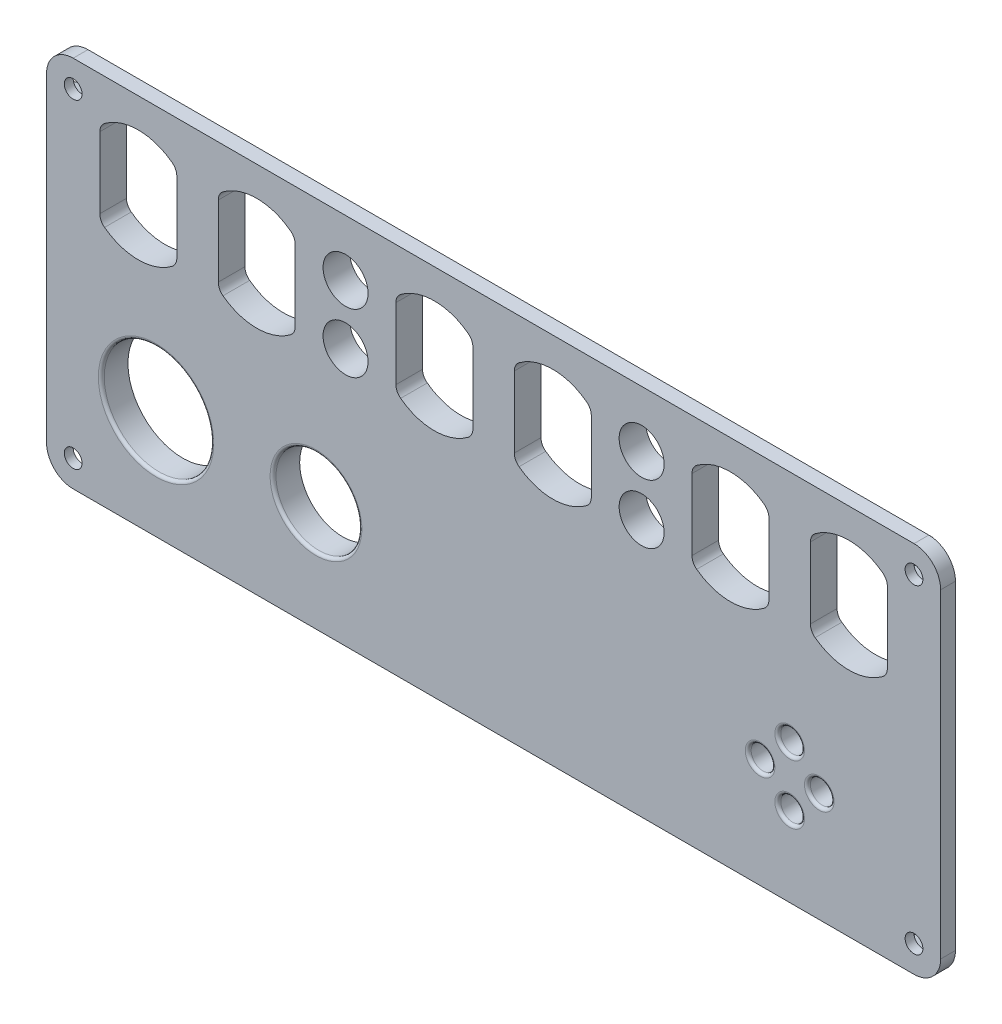
from build123d import *

# Parameters (mm, degrees)
SKETCH_1_R          = 1.5
EXTRUDE_1_DEPTH     = 4.5
CUT_EXTRUDE_START   = -3
SKETCH_2_R          = 1.5
CUT_EXTRUDE_1_DEPTH = 3
SKETCH_3_R          = 3.8
CUT_EXTRUDE_2_DEPTH = 6
SKETCH_4_R          = 9.25
SKETCH_4_R_2        = 7.25
CUT_EXTRUDE_3_DEPTH = 6
SKETCH_5_R          = 2
CUT_EXTRUDE_4_DEPTH = 5
FILLET_1_R          = 2
CUT_EXTRUDE_START_2 = -2
CUT_EXTRUDE_5_DEPTH = 2
FILLET_2_R          = 1
FILLET_3_R          = 0.5
FILLET_4_R          = 0.5


with BuildPart() as part:
    # 草图1 → 凸台-拉伸1 (new body)
    with BuildSketch(Plane.XY):
        with BuildLine():
            Line((-71, 31.5), (71, 31.5))
            ThreePointArc((71, 31.5), (74.181980515, 30.181980515), (75.5, 27))
            Line((75.5, 27), (75.5, -27))
            ThreePointArc((75.5, -27), (74.181980515, -30.181980515), (71, -31.5))
            Line((71, -31.5), (-71, -31.5))
            ThreePointArc((-71, -31.5), (-74.181980515, -30.181980515), (-75.5, -27))
            Line((-75.5, -27), (-75.5, 27))
            ThreePointArc((-75.5, 27), (-74.181980515, 30.181980515), (-71, 31.5))
        make_face()
        with Locations((-71, 27)):
            Circle(SKETCH_1_R, mode=Mode.SUBTRACT)
        with Locations(Location((71, 27, 0), (0, 0, 180))):
            Circle(SKETCH_1_R, mode=Mode.SUBTRACT)
        with Locations((71, -27)):
            Circle(SKETCH_1_R, mode=Mode.SUBTRACT)
        with Locations(Location((-71, -27, 0), (0, 0, 180))):
            Circle(SKETCH_1_R, mode=Mode.SUBTRACT)
    extrude(amount=-EXTRUDE_1_DEPTH)

    # 草图2 → 切除-拉伸1 (cut)
    # profile 1 of 4: a face of its own
    with BuildSketch(Plane(origin=(0, 0, -4.5), x_dir=(-1, 0, 0), z_dir=(0, 0, -1)).offset(CUT_EXTRUDE_START)):
        Polygon((-71, 23.7), (-68.142116168, 25.35), (-68.142116168, 28.65), (-71, 30.3), (-73.857883832, 28.65), (-73.857883832, 25.35), align=None)
        with Locations((-71, 27)):
            Circle(SKETCH_2_R, mode=Mode.SUBTRACT)
    # profile 2 of 4: a face of its own
    with BuildSketch(Plane(origin=(0, 0, -4.5), x_dir=(-1, 0, 0), z_dir=(0, 0, -1)).offset(CUT_EXTRUDE_START)):
        Polygon((71, 30.3), (73.857883832, 28.65), (73.857883832, 25.35), (71, 23.7), (68.142116168, 25.35), (68.142116168, 28.65), align=None)
    # profile 3 of 4: a face of its own
    with BuildSketch(Plane(origin=(0, 0, -4.5), x_dir=(-1, 0, 0), z_dir=(0, 0, -1)).offset(CUT_EXTRUDE_START)):
        Polygon((73.857883832, -28.65), (73.857883832, -25.35), (71, -23.7), (68.142116168, -25.35), (68.142116168, -28.65), (71, -30.3), align=None)
    # profile 4 of 4: a face of its own
    with BuildSketch(Plane(origin=(0, 0, -4.5), x_dir=(-1, 0, 0), z_dir=(0, 0, -1)).offset(CUT_EXTRUDE_START)):
        Polygon((-71, -30.3), (-73.857883832, -28.65), (-73.857883832, -25.35), (-71, -23.7), (-68.142116168, -25.35), (-68.142116168, -28.65), align=None)
    extrude(amount=CUT_EXTRUDE_1_DEPTH, mode=Mode.SUBTRACT)

    # 草图3 → 切除-拉伸2 (cut)
    with BuildSketch(Plane.XY):
        with Locations((-25, 22)):
            Circle(SKETCH_3_R)
        with Locations(Location((-25, 12, 0), (0, 0, 180))):
            Circle(SKETCH_3_R)
        with Locations((25, 12)):
            Circle(SKETCH_3_R)
        with Locations(Location((25, 22, 0), (0, 0, 180))):
            Circle(SKETCH_3_R)
        with BuildLine():
            Line((-53.5, 17), (-53.5, 23.92820323))
            ThreePointArc((-53.5, 23.92820323), (-60, 26.5), (-66.5, 23.92820323))
            Line((-66.5, 23.92820323), (-66.5, 17))
            Line((-66.5, 17), (-66.5, 10.07179677))
            ThreePointArc((-66.5, 10.07179677), (-60, 7.5), (-53.5, 10.07179677))
            Line((-53.5, 10.07179677), (-53.5, 17))
        make_face()
        with BuildLine():
            Line((-33.5, 17), (-33.5, 10.07179677))
            ThreePointArc((-33.5, 10.07179677), (-40, 7.5), (-46.5, 10.07179677))
            Line((-46.5, 10.07179677), (-46.5, 17))
            Line((-46.5, 17), (-46.5, 23.92820323))
            ThreePointArc((-46.5, 23.92820323), (-40, 26.5), (-33.5, 23.92820323))
            Line((-33.5, 23.92820323), (-33.5, 17))
        make_face()
        with BuildLine():
            Line((-3.5, 17), (-3.5, 10.07179677))
            ThreePointArc((-3.5, 10.07179677), (-10, 7.5), (-16.5, 10.07179677))
            Line((-16.5, 10.07179677), (-16.5, 17))
            Line((-16.5, 17), (-16.5, 23.92820323))
            ThreePointArc((-16.5, 23.92820323), (-10, 26.5), (-3.5, 23.92820323))
            Line((-3.5, 23.92820323), (-3.5, 17))
        make_face()
        with BuildLine():
            Line((16.5, 17), (16.5, 10.07179677))
            ThreePointArc((16.5, 10.07179677), (10, 7.5), (3.5, 10.07179677))
            Line((3.5, 10.07179677), (3.5, 17))
            Line((3.5, 17), (3.5, 23.92820323))
            ThreePointArc((3.5, 23.92820323), (10, 26.5), (16.5, 23.92820323))
            Line((16.5, 23.92820323), (16.5, 17))
        make_face()
        with BuildLine():
            Line((46.5, 17), (46.5, 10.07179677))
            ThreePointArc((46.5, 10.07179677), (40, 7.5), (33.5, 10.07179677))
            Line((33.5, 10.07179677), (33.5, 17))
            Line((33.5, 17), (33.5, 23.92820323))
            ThreePointArc((33.5, 23.92820323), (40, 26.5), (46.5, 23.92820323))
            Line((46.5, 23.92820323), (46.5, 17))
        make_face()
        with BuildLine():
            Line((53.5, 17), (53.5, 10.07179677))
            ThreePointArc((53.5, 10.07179677), (60, 7.5), (66.5, 10.07179677))
            Line((66.5, 10.07179677), (66.5, 17))
            Line((66.5, 17), (66.5, 23.92820323))
            ThreePointArc((66.5, 23.92820323), (60, 26.5), (53.5, 23.92820323))
            Line((53.5, 23.92820323), (53.5, 17))
        make_face()
    extrude(amount=-CUT_EXTRUDE_2_DEPTH, mode=Mode.SUBTRACT)

    # 草图4 → 切除-拉伸3 (cut)
    with BuildSketch(Plane.XY):
        with Locations((-57, -13)):
            Circle(SKETCH_4_R)
        with Locations((-30, -13)):
            Circle(SKETCH_4_R_2)
    extrude(amount=-CUT_EXTRUDE_3_DEPTH, mode=Mode.SUBTRACT)

    # 草图5 → 切除-拉伸4 (cut)
    with BuildSketch(Plane(origin=(0, 0, -4.5), x_dir=(-1, 0, 0), z_dir=(0, 0, -1))):
        with Locations((-45, -13)):
            Circle(SKETCH_5_R)
        with Locations((-55, -13)):
            Circle(SKETCH_5_R)
        with Locations((-50, -8)):
            Circle(SKETCH_5_R)
        with Locations((-50, -18)):
            Circle(SKETCH_5_R)
    extrude(amount=-CUT_EXTRUDE_4_DEPTH, mode=Mode.SUBTRACT)

    # 圆角1
    fillet_1_edges = [part.edges().sort_by_distance(p)[0] for p in [
        (-66.5, 23.92820323, -2.25),
        (-53.5, 23.92820323, -2.25),
        (-53.5, 10.07179677, -2.25),
        (-66.5, 10.07179677, -2.25),
        (-33.5, 23.92820323, -2.25),
        (-33.5, 10.07179677, -2.25),
        (-46.5, 10.07179677, -2.25),
        (-46.5, 23.92820323, -2.25),
        (-3.5, 23.92820323, -2.25),
        (-3.5, 10.07179677, -2.25),
        (-16.5, 10.07179677, -2.25),
        (-16.5, 23.92820323, -2.25),
        (16.5, 23.92820323, -2.25),
        (16.5, 10.07179677, -2.25),
        (3.5, 10.07179677, -2.25),
        (3.5, 23.92820323, -2.25),
        (46.5, 23.92820323, -2.25),
        (46.5, 10.07179677, -2.25),
        (33.5, 10.07179677, -2.25),
        (33.5, 23.92820323, -2.25),
        (66.5, 10.07179677, -2.25),
        (53.5, 10.07179677, -2.25),
        (53.5, 23.92820323, -2.25),
        (66.5, 23.92820323, -2.25),
    ]]
    fillet(fillet_1_edges, radius=FILLET_1_R)

    # 草图6 → 切除-拉伸5 (cut)
    with BuildSketch(Plane(origin=(0, 0, -4.5), x_dir=(-1, 0, 0), z_dir=(0, 0, -1)).offset(CUT_EXTRUDE_START_2)):
        with BuildLine():
            Line((-75.5, -27), (-75.5, 27))
            ThreePointArc((-75.5, 27), (-74.181980515, 30.181980515), (-71, 31.5))
            Line((-71, 31.5), (71, 31.5))
            ThreePointArc((71, 31.5), (74.181980515, 30.181980515), (75.5, 27))
            Line((75.5, 27), (75.5, -27))
            ThreePointArc((75.5, -27), (74.181980515, -30.181980515), (71, -31.5))
            Line((71, -31.5), (-71, -31.5))
            ThreePointArc((-71, -31.5), (-74.181980515, -30.181980515), (-75.5, -27))
        make_face()
        with BuildLine():
            Line((71, -29.5), (-71, -29.5))
            ThreePointArc((-71, -29.5), (-72.767766953, -28.767766953), (-73.5, -27))
            Line((-73.5, -27), (-73.5, 27))
            ThreePointArc((-73.5, 27), (-72.767766953, 28.767766953), (-71, 29.5))
            Line((-71, 29.5), (71, 29.5))
            ThreePointArc((71, 29.5), (72.767766953, 28.767766953), (73.5, 27))
            Line((73.5, 27), (73.5, -27))
            ThreePointArc((73.5, -27), (72.767766953, -28.767766953), (71, -29.5))
        make_face(mode=Mode.SUBTRACT)
    extrude(amount=CUT_EXTRUDE_5_DEPTH, mode=Mode.SUBTRACT)

    # 圆角2
    # the kernel refuses this fillet: 1 mm, written as the material it adds along each edge
    with BuildSketch(Plane(origin=(-73.5, 27.643375673, -2.5), x_dir=(-1, 0, 0), z_dir=(0, -1, 0))) as fillet_2_piece_1_section:
        with BuildLine():
            CenterArc((FILLET_2_R, FILLET_2_R), FILLET_2_R, 180, 90)
            Line((0, FILLET_2_R), (0, 0))
            Line((0, 0), (FILLET_2_R, 0))
        make_face()
    fillet_2_piece_1 = extrude(amount=55.286751346, mode=Mode.PRIVATE)
    fillet_2_piece_1 = split(fillet_2_piece_1, bisect_by=Plane(origin=(-62.998675365, 19.080433068, -2.568269358), z_dir=(-0.4999999999999995, -0.866025403784439, 0)), keep=Keep.TOP, mode=Mode.PRIVATE)
    fillet_2_piece_1 = split(fillet_2_piece_1, bisect_by=Plane(origin=(-62.998675365, -19.080433068, -2.568269358), z_dir=(-0.4999999999999995, 0.866025403784439, 0)), keep=Keep.TOP, mode=Mode.PRIVATE)
    add(fillet_2_piece_1)
    with BuildSketch(Plane(origin=(72.114359354, 29.5, -2.5), x_dir=(0, 1, 0), z_dir=(-1, 0, 0))) as fillet_2_piece_2_section:
        with BuildLine():
            CenterArc((FILLET_2_R, FILLET_2_R), FILLET_2_R, 180, 90)
            Line((0, FILLET_2_R), (0, 0))
            Line((0, 0), (FILLET_2_R, 0))
        make_face()
    fillet_2_piece_2 = extrude(amount=144.228718708, mode=Mode.PRIVATE)
    fillet_2_piece_2 = split(fillet_2_piece_2, bisect_by=Plane(origin=(71.034600917, 30.319976849, -2.504027252), z_dir=(-0.4999999999999995, 0.866025403784439, 0)), keep=Keep.TOP, mode=Mode.PRIVATE)
    fillet_2_piece_2 = split(fillet_2_piece_2, bisect_by=Plane(origin=(35.465399084, -31.167826821, -2.504027252), z_dir=(0.4999999999999987, 0.8660254037844395, 0)), keep=Keep.TOP, mode=Mode.PRIVATE)
    add(fillet_2_piece_2)
    with BuildSketch(Plane(origin=(73.5, -27.643375673, -2.5), x_dir=(1, 0, 0), z_dir=(0, 1, 0))) as fillet_2_piece_3_section:
        with BuildLine():
            CenterArc((FILLET_2_R, FILLET_2_R), FILLET_2_R, 180, 90)
            Line((0, FILLET_2_R), (0, 0))
            Line((0, 0), (FILLET_2_R, 0))
        make_face()
    fillet_2_piece_3 = extrude(amount=55.286751346, mode=Mode.PRIVATE)
    fillet_2_piece_3 = split(fillet_2_piece_3, bisect_by=Plane(origin=(62.998675365, -19.080433068, -2.568269358), z_dir=(0.5000000000000013, 0.8660254037844379, 0)), keep=Keep.TOP, mode=Mode.PRIVATE)
    fillet_2_piece_3 = split(fillet_2_piece_3, bisect_by=Plane(origin=(62.998675365, 19.080433068, -2.568269358), z_dir=(0.5000000000000013, -0.8660254037844379, 0)), keep=Keep.TOP, mode=Mode.PRIVATE)
    add(fillet_2_piece_3)
    with BuildSketch(Plane(origin=(-72.114359354, -29.5, -2.5), x_dir=(0, -1, 0), z_dir=(1, 0, 0))) as fillet_2_piece_4_section:
        with BuildLine():
            CenterArc((FILLET_2_R, FILLET_2_R), FILLET_2_R, 180, 90)
            Line((0, FILLET_2_R), (0, 0))
            Line((0, 0), (FILLET_2_R, 0))
        make_face()
    fillet_2_piece_4 = extrude(amount=144.228718708, mode=Mode.PRIVATE)
    fillet_2_piece_4 = split(fillet_2_piece_4, bisect_by=Plane(origin=(-71.034600917, -30.319976849, -2.504027252), z_dir=(0.4999999999999995, -0.866025403784439, 0)), keep=Keep.TOP, mode=Mode.PRIVATE)
    fillet_2_piece_4 = split(fillet_2_piece_4, bisect_by=Plane(origin=(-35.465399084, 31.167826821, -2.504027252), z_dir=(-0.4999999999999995, -0.866025403784439, 0)), keep=Keep.TOP, mode=Mode.PRIVATE)
    add(fillet_2_piece_4)

    # 圆角3
    fillet_3_edges = [part.edges().sort_by_distance(p)[0] for p in [
        (47, -13, 0),
        (57, -13, 0),
        (52, -8, 0),
        (52, -18, 0),
    ]]
    fillet(fillet_3_edges, radius=FILLET_3_R)

    # 圆角4
    fillet_4_edges = [part.edges().sort_by_distance(p)[0] for p in [
        (-37.25, -13, 0),
        (-66.25, -13, 0),
    ]]
    fillet(fillet_4_edges, radius=FILLET_4_R)


solid = part.part
